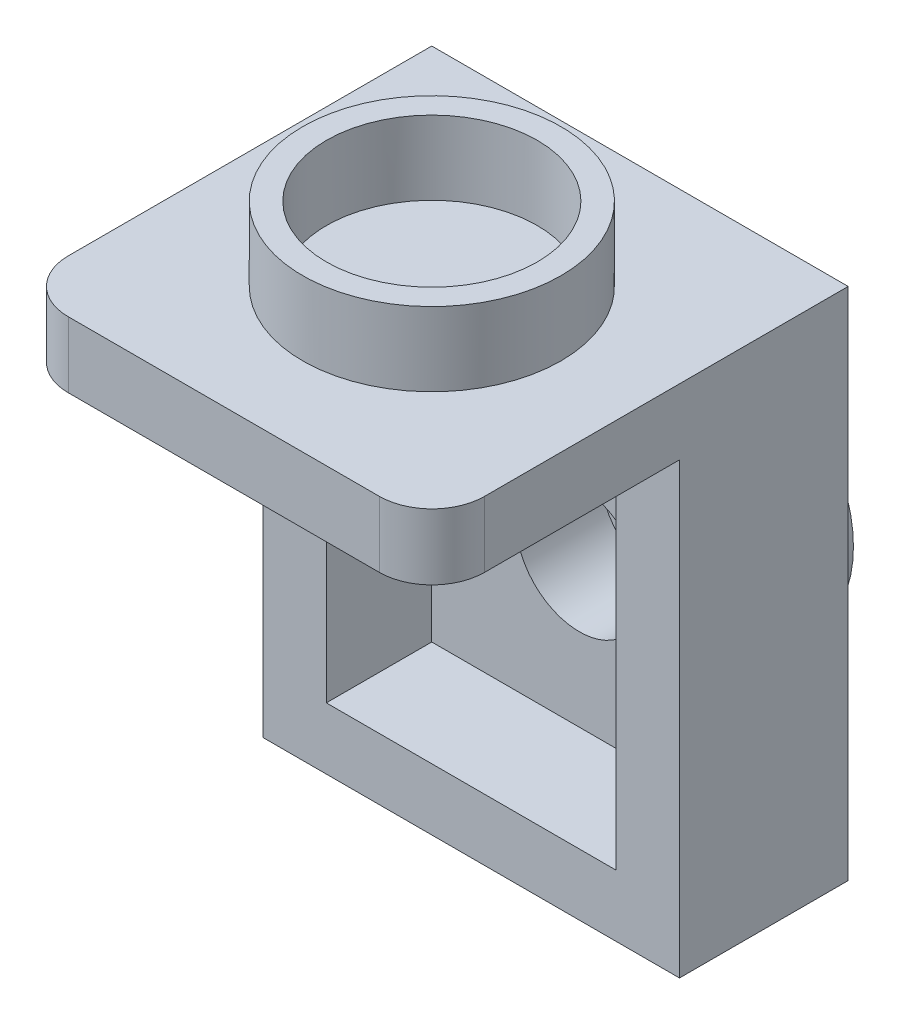
from build123d import *

# Parameters (mm, degrees)
MAINBASESKETCH_W             = 15.8
MAINBASESKETCH_H             = 3.2
MAINBASEEXTRUDE_DEPTH        = 7.9
STUDSSKETCH_R                = 2.4
STUDSEXTRUDE_DEPTH           = 1.6
STUDSPATTERN_COUNT           = 2
STUDSPATTERN_PITCH           = 8
STUDSPATTERN_COUNT_DIR2      = 2
STUDSPATTERN_PITCH_DIR2      = 8
LCUTBLUE_DEPTH               = 19.555463972
LCUTBLUE_DEPTH_BACK          = 19.555463972
MADESLIMCUTSKETCH_W          = 7.9
MADESLIMCUTSKETCH_H          = 7.9
MADESLIMCUT_DEPTH            = 19.897228453
SHORTLEXTENSIONSKETCH_W      = 1.583745828
SHORTLEXTENSIONSKETCH_H      = 7.9
SHORTLUPPERCIRCLES_START     = -0.2
SHORTLUPPERCIRCLESSKETCH_R   = 2.45
SHORTLUPPERCIRCLESSKETCH_R_2 = 2
SHORTLUPPERCIRCLES_DEPTH     = 1.6
CUT_EXTRUDE17_DEPTH          = 7.9
SKETCH63_W                   = 1.583745828
SKETCH63_H                   = 7.9
LPATTERN2_START              = -2.983745828
LPATTERN2_OUTLINE_R          = 2.45
LPATTERN2_OUTLINE_R_2        = 2
LPATTERN2_DEPTH              = 1.4
FILLET4_R                    = 1
REMOVEDMATERIAL_DEPTH        = 21.328098686
REMOVEDMATERIAL_DEPTH_BACK   = 21.328098686
SKETCH114_W                  = 7.9
SKETCH114_H                  = 7.87601279
FILLET20_R                   = 1
BOSS_EXTRUDE7_START          = -0.2
SKETCH117_R                  = 2.45
SKETCH117_R_2                = 2
BOSS_EXTRUDE7_DEPTH          = 1.6
SKETCH118_W                  = 1.583745828
SKETCH118_H                  = 4.72398721
CUT_EXTRUDE43_DEPTH          = 14.697064405
SKETCH120_R                  = 2.45
SKETCH120_R_2                = 2
CUT_EXTRUDE44_DEPTH          = 1.6
SKETCH123_W                  = 4.8
SKETCH123_H                  = 1.6
SKETCH123_W_2                = 1.4
SKETCH123_H_2                = 4.9
CUT_EXTRUDE45_DEPTH          = 14.697064405
SKETCH124_R                  = 2.4
BOSS_EXTRUDE11_DEPTH         = 1.6
SKETCH125_W                  = 7.9
SKETCH125_H                  = 1.588006001
CUT_EXTRUDE46_DEPTH          = 17.118413467
BOSS_EXTRUDE12_START         = -0.2
SKETCH126_R                  = 2.45
SKETCH126_R_2                = 2
BOSS_EXTRUDE12_DEPTH         = 1.6
SKETCH128_W                  = 6.311993999
SKETCH128_H                  = 1.950598033
CUT_EXTRUDE47_DEPTH          = 13.846822236
SKETCH129_W                  = 1.616254172
SKETCH129_H                  = 9.874585243
FILLET23_R                   = 1
SHELL8_START                 = -0.383745828
SHELL8_OUTLINE_W             = 5.5
SHELL8_OUTLINE_H             = 8.72398721
SHELL8_DEPTH                 = 2
SHELL8_START_2               = -1.983745828
SHELL8_2_OUTLINE_R           = 1.2
SHELL8_2_DEPTH               = 1.6
BOSS_EXTRUDE13_START         = -7.92398721
BOSS_EXTRUDE13_OUTLINE_W     = 7.9
BOSS_EXTRUDE13_OUTLINE_H     = 3.2
BOSS_EXTRUDE13_DEPTH         = 1
SWEEP22_START                = 1.950598033
SWEEP22_OUTLINE_W            = 5.5
SWEEP22_OUTLINE_H            = 2
SWEEP22_DEPTH                = 0.049401967
BOSS_EXTRUDE14_REACH         = 15.829
BOSS_EXTRUDE14_START         = -1.2
SKETCH133_W                  = 1.111883757
SKETCH133_H                  = 1
SKETCH136_W                  = 7.9
SKETCH136_H                  = 1.361659972
CUT_EXTRUDE48_DEPTH          = 15.099022731
SWEEP23_START                = -0.383745828
SWEEP23_OUTLINE_W            = 5.5
SWEEP23_OUTLINE_H            = 1.170292465
SWEEP23_DEPTH                = 2


# Read off the part's stored shape, not the designer's step: LPattern2, Shell8, Boss-Extrude13, Sweep22, Sweep23
with BuildPart() as part:
    # MainBaseSketch → MainBaseExtrude (new, symmetric)
    with BuildSketch(Plane.XY):
        with Locations((8.581967213, 1.6)):
            Rectangle(MAINBASESKETCH_W, MAINBASESKETCH_H)
    extrude(amount=MAINBASEEXTRUDE_DEPTH, both=True)

    # StudsSketch → StudsExtrude (add)
    with BuildSketch(Plane(origin=(0, 3.2, 0), x_dir=(1, 0, 0), z_dir=(0, 1, 0))):
        with Locations((4.581967213, 4)):
            Circle(STUDSSKETCH_R)
    studsextrude = extrude(amount=STUDSEXTRUDE_DEPTH)

    # StudsPattern: StudsExtrude 2 × 2
    with Locations(*[(j * STUDSPATTERN_PITCH_DIR2, 0, i * STUDSPATTERN_PITCH) for i in range(STUDSPATTERN_COUNT) for j in range(STUDSPATTERN_COUNT_DIR2) if (i, j) != (0, 0)]):
        add(studsextrude)

    # LCUTBlueSketch → LCutBlue (cut, two sides: drawn at the far end of the back side and taken through both)
    with BuildSketch(Plane(origin=(0, 3.2, 0), x_dir=(1, 0, 0), z_dir=(0, 1, 0)).offset(-LCUTBLUE_DEPTH_BACK)):
        Polygon((8.581967213, 53.229874044), (8.581967213, 7.9), (8.581967213, 0), (16.481967213, 0), (61.811841258, 0), (125.917963912, 64.106122654), (72.688089868, 117.335996699), align=None)
    extrude(amount=LCUTBLUE_DEPTH + LCUTBLUE_DEPTH_BACK, mode=Mode.SUBTRACT)

    # MadeSlimCutSketch → MadeSlimCut (cut, through all)
    with BuildSketch(Plane.XZ):
        with Locations((4.631967213, -3.95)):
            Rectangle(MADESLIMCUTSKETCH_W, MADESLIMCUTSKETCH_H)
    extrude(amount=-MADESLIMCUT_DEPTH, mode=Mode.SUBTRACT)

    # ShortLExtension: sweep along a curve in space
    with BuildLine() as shortlextension_path:
        Line((0.681967213, 3.2, 0), (16.481967213, 3.2, 0))
    # ShortLExtensionSketch → ShortLExtension (sweep)
    with BuildSketch(Plane(origin=(16.481967213, 0, 0), x_dir=(0, 0, -1), z_dir=(1, 0, 0))):
        with Locations((0.791872914, 3.95)):
            Rectangle(SHORTLEXTENSIONSKETCH_W, SHORTLEXTENSIONSKETCH_H)
    sweep(path=shortlextension_path.line)

    # ShortLUpperCirclesSketch → ShortLUpperCircles (add)
    # profile 1 of 2: a face of its own
    with BuildSketch(Plane(origin=(0, 0, -1.583745828), x_dir=(-1, 0, 0), z_dir=(0, 0, -1)).offset(SHORTLUPPERCIRCLES_START)):
        with Locations(Location((-12.581967213, 3.95, 0), (0, 0, 90))):
            Circle(SHORTLUPPERCIRCLESSKETCH_R)
        with Locations(Location((-12.581967213, 3.95, 0), (0, 0, 90))):
            Circle(SHORTLUPPERCIRCLESSKETCH_R_2, mode=Mode.SUBTRACT)
    # profile 2 of 2: a face of its own
    with BuildSketch(Plane(origin=(0, 0, -1.583745828), x_dir=(-1, 0, 0), z_dir=(0, 0, -1)).offset(SHORTLUPPERCIRCLES_START)):
        with Locations(Location((-4.581967213, 3.95, 0), (0, 0, 270))):
            Circle(SHORTLUPPERCIRCLESSKETCH_R)
        with Locations(Location((-4.581967213, 3.95, 0), (0, 0, 270))):
            Circle(SHORTLUPPERCIRCLESSKETCH_R_2, mode=Mode.SUBTRACT)
    extrude(amount=SHORTLUPPERCIRCLES_DEPTH)

    # Sketch59 → Cut-Extrude17 (cut)
    with BuildSketch(Plane.ZY.offset(-8.581967213)):
        Polygon((-1.583745828, 6.4), (-1.583745828, 7.9), (0, 7.9), (0, 3.2), (1.6, 3.2), (1.6, 4.8), (6.4, 4.8), (6.4, 3.2), (7.9, 3.2), (7.9, 0), (-1.583745828, 0), (-1.583745828, 1.5), (-2.983745828, 1.5), (-2.983745828, 6.4), align=None)
    extrude(amount=-CUT_EXTRUDE17_DEPTH, mode=Mode.SUBTRACT)

    # Sweep5: sweep along a curve in space
    with BuildLine() as sweep5_path:
        Line((0.681967213, 7.9, 0), (8.581967213, 7.9, 0))
    # Sketch63 → Sweep5 (sweep)
    with BuildSketch(Plane.ZY.offset(-0.681967213)):
        with Locations((-0.791872914, 11.85)):
            Rectangle(SKETCH63_W, SKETCH63_H)
    sweep(path=sweep5_path.line)

    # LPattern2 outline → LPattern2 (add)
    with BuildSketch(Plane.XY.offset(LPATTERN2_START)):
        with Locations((4.581967213, 11.95)):
            Circle(LPATTERN2_OUTLINE_R)
        with Locations((4.581967213, 11.95)):
            Circle(LPATTERN2_OUTLINE_R_2, mode=Mode.SUBTRACT)
    extrude(amount=LPATTERN2_DEPTH)

    # Fillet4
    fillet4_edges = [part.edges().sort_by_distance(p)[0] for p in [
        (0.681967213, 15.8, -0.791872914),
        (8.581967213, 15.8, -0.791872914),
    ]]
    fillet(fillet4_edges, radius=FILLET4_R)

    # Sketch114 → RemovedMaterial (cut, two sides: drawn at the far end of the back side and taken through both)
    with BuildSketch(Plane(origin=(0, 0, -1.583745828), x_dir=(-1, 0, 0), z_dir=(0, 0, -1)).offset(-REMOVEDMATERIAL_DEPTH_BACK)):
        with Locations((-4.631967213, 11.861993605)):
            Rectangle(SKETCH114_W, SKETCH114_H)
    extrude(amount=REMOVEDMATERIAL_DEPTH + REMOVEDMATERIAL_DEPTH_BACK, mode=Mode.SUBTRACT)

    # Fillet20
    fillet20_edges = [part.edges().sort_by_distance(p)[0] for p in [
        (8.581967213, 7.92398721, -0.791872914),
        (0.681967213, 7.92398721, -0.791872914),
    ]]
    fillet(fillet20_edges, radius=FILLET20_R)

    # Sweep20: sweep along a curve in space
    with BuildLine() as sweep20_path:
        Line((0.681967213, 6.92398721, 0), (0.681967213, 6.92398721, -1.583745828))
    # Sketch115 → Sweep20 (sweep)
    with BuildSketch(Plane(origin=(0, 0, -1.583745828), x_dir=(-1, 0, 0), z_dir=(0, 0, -1))):
        with BuildLine():
            Line((-8.581967213, -6.92398721), (-8.581967213, 0))
            Line((-8.581967213, 0), (-0.681967213, 0))
            Line((-0.681967213, 0), (-0.681967213, -6.92398721))
            ThreePointArc((-0.681967213, -6.92398721), (-0.974860432, -7.631093991), (-1.681967213, -7.92398721))
            Line((-1.681967213, -7.92398721), (-7.581967213, -7.92398721))
            ThreePointArc((-7.581967213, -7.92398721), (-8.289073994, -7.631093991), (-8.581967213, -6.92398721))
        make_face()
    sweep(path=sweep20_path.line)

    # Sketch117 → Boss-Extrude7 (add)
    with BuildSketch(Plane(origin=(0, 0, -1.583745828), x_dir=(-1, 0, 0), z_dir=(0, 0, -1)).offset(BOSS_EXTRUDE7_START)):
        with Locations(Location((-4.631967213, -3.961993605, 0), (0, 0, 90))):
            Circle(SKETCH117_R)
        with Locations(Location((-4.631967213, -3.961993605, 0), (0, 0, 90))):
            Circle(SKETCH117_R_2, mode=Mode.SUBTRACT)
    extrude(amount=BOSS_EXTRUDE7_DEPTH)

    # Sketch118 → Cut-Extrude43 (cut, through all)
    with BuildSketch(Plane.ZY.offset(-0.681967213)):
        with Locations((-0.791872914, 5.561993605)):
            Rectangle(SKETCH118_W, SKETCH118_H)
    extrude(amount=-CUT_EXTRUDE43_DEPTH, mode=Mode.SUBTRACT)

    # Sketch120 → Cut-Extrude44 (cut)
    with BuildSketch(Plane(origin=(0, 0, -1.583745828), x_dir=(-1, 0, 0), z_dir=(0, 0, -1))):
        with Locations((-4.581967213, 3.95)):
            Circle(SKETCH120_R)
        with Locations((-4.581967213, 3.95)):
            Circle(SKETCH120_R_2, mode=Mode.SUBTRACT)
    extrude(amount=CUT_EXTRUDE44_DEPTH, mode=Mode.SUBTRACT)

    # Sketch123 → Cut-Extrude45 (cut, through all)
    with BuildSketch(Plane.ZY.offset(-0.681967213)):
        with Locations((4, 4)):
            Rectangle(SKETCH123_W, SKETCH123_H)
        with Locations((-2.283745828, -3.961993605)):
            Rectangle(SKETCH123_W_2, SKETCH123_H_2)
    extrude(amount=-CUT_EXTRUDE45_DEPTH, mode=Mode.SUBTRACT)

    # Sketch124 → Boss-Extrude11 (add)
    with BuildSketch(Plane(origin=(0, 0, -1.583745828), x_dir=(-1, 0, 0), z_dir=(0, 0, -1))):
        with Locations(Location((-4.681967213, -2.62398721, 0), (0, 0, 90))):
            Circle(SKETCH124_R)
    extrude(amount=BOSS_EXTRUDE11_DEPTH)

    # Sketch125 → Cut-Extrude46 (cut, through all)
    with BuildSketch(Plane(origin=(0, 3.2, 0), x_dir=(1, 0, 0), z_dir=(0, 1, 0))):
        with Locations((4.631967213, -7.105997)):
            Rectangle(SKETCH125_W, SKETCH125_H)
    extrude(amount=-CUT_EXTRUDE46_DEPTH, mode=Mode.SUBTRACT)

    # Sketch126 → Boss-Extrude12 (add)
    with BuildSketch(Plane(origin=(0, 3.2, 0), x_dir=(1, 0, 0), z_dir=(0, 1, 0)).offset(BOSS_EXTRUDE12_START)):
        with Locations((4.631967213, -2.364124086)):
            Circle(SKETCH126_R)
        with Locations((4.631967213, -2.364124086)):
            Circle(SKETCH126_R_2, mode=Mode.SUBTRACT)
    extrude(amount=BOSS_EXTRUDE12_DEPTH)

    # Sketch128 → Cut-Extrude47 (cut, through all)
    with BuildSketch(Plane.ZY.offset(-0.681967213)):
        with Locations((3.155997, 0.975299017)):
            Rectangle(SKETCH128_W, SKETCH128_H)
    extrude(amount=-CUT_EXTRUDE47_DEPTH, mode=Mode.SUBTRACT)

    # Sweep21: sweep along a curve in space
    with BuildLine() as sweep21_path:
        Line((8.581967213, 1.950598033, 0), (0.681967213, 1.950598033, 0))
    # Sketch129 → Sweep21 (sweep)
    with BuildSketch(Plane.ZY.offset(-0.681967213)):
        with Locations((0.808127086, -2.986694589)):
            Rectangle(SKETCH129_W, SKETCH129_H)
    sweep(path=sweep21_path.line)

    # Fillet23
    fillet23_edges = [part.edges().sort_by_distance(p)[0] for p in [
        (8.581967213, 2.575299016, 6.311993999),
        (0.681967213, 2.575299016, 6.311993999),
        (0.681967213, -7.92398721, 0.808127086),
        (8.581967213, -7.92398721, 0.808127086),
    ]]
    fillet(fillet23_edges, radius=FILLET23_R)

    # Shell8 outline → Shell8 (cut)
    with BuildSketch(Plane.XY.offset(SHELL8_START)):
        with Locations((4.631967213, -2.361993605)):
            Rectangle(SHELL8_OUTLINE_W, SHELL8_OUTLINE_H)
    extrude(amount=SHELL8_DEPTH, mode=Mode.SUBTRACT)

    # Shell8 2 outline → Shell8 2 (cut)
    with BuildSketch(Plane.XY.offset(SHELL8_START_2)):
        with Locations((4.681967213, -2.62398721)):
            Circle(SHELL8_2_OUTLINE_R)
    extrude(amount=SHELL8_2_DEPTH, mode=Mode.SUBTRACT)

    # Boss-Extrude13 outline → Boss-Extrude13 (add)
    with BuildSketch(Plane(origin=(0, 0, 0), x_dir=(1, 0, 0), z_dir=(0, 1, 0)).offset(BOSS_EXTRUDE13_START)):
        with Locations((4.631967213, -0.016254172)):
            Rectangle(BOSS_EXTRUDE13_OUTLINE_W, BOSS_EXTRUDE13_OUTLINE_H)
    extrude(amount=BOSS_EXTRUDE13_DEPTH)

    # Sweep22 outline → Sweep22 (add)
    with BuildSketch(Plane(origin=(0, 0, 0), x_dir=(1, 0, 0), z_dir=(0, 1, 0)).offset(SWEEP22_START)):
        with Locations((4.631967213, -0.616254172)):
            Rectangle(SWEEP22_OUTLINE_W, SWEEP22_OUTLINE_H)
    extrude(amount=SWEEP22_DEPTH)

    # Sketch133 → Boss-Extrude14 (add, up to next)
    with BuildSketch(Plane.XY.offset(1.616254172).offset(BOSS_EXTRUDE14_START), mode=Mode.PRIVATE) as boss_extrude14_sk1:
        with Locations((4.652702787, 1.450598033)):
            Rectangle(SKETCH133_W, SKETCH133_H)
    boss_extrude14_tool1 = extrude(boss_extrude14_sk1.sketch, amount=-BOSS_EXTRUDE14_REACH, mode=Mode.PRIVATE) - part.part
    add(boss_extrude14_tool1.solids().sort_by_distance((4.652703, 1.450598, 0.416254))[0])

    # Sketch136 → Cut-Extrude48 (cut, through all)
    with BuildSketch(Plane(origin=(0, 0, -1.583745828), x_dir=(-1, 0, 0), z_dir=(0, 0, -1))):
        with Locations((-4.631967213, -7.243157224)):
            Rectangle(SKETCH136_W, SKETCH136_H)
    extrude(amount=-CUT_EXTRUDE48_DEPTH, mode=Mode.SUBTRACT)

    # Sweep23 outline → Sweep23 (add)
    with BuildSketch(Plane.XY.offset(SWEEP23_START)):
        with Locations((4.631967213, -5.977181006)):
            Rectangle(SWEEP23_OUTLINE_W, SWEEP23_OUTLINE_H)
    extrude(amount=SWEEP23_DEPTH)


solid = part.part
